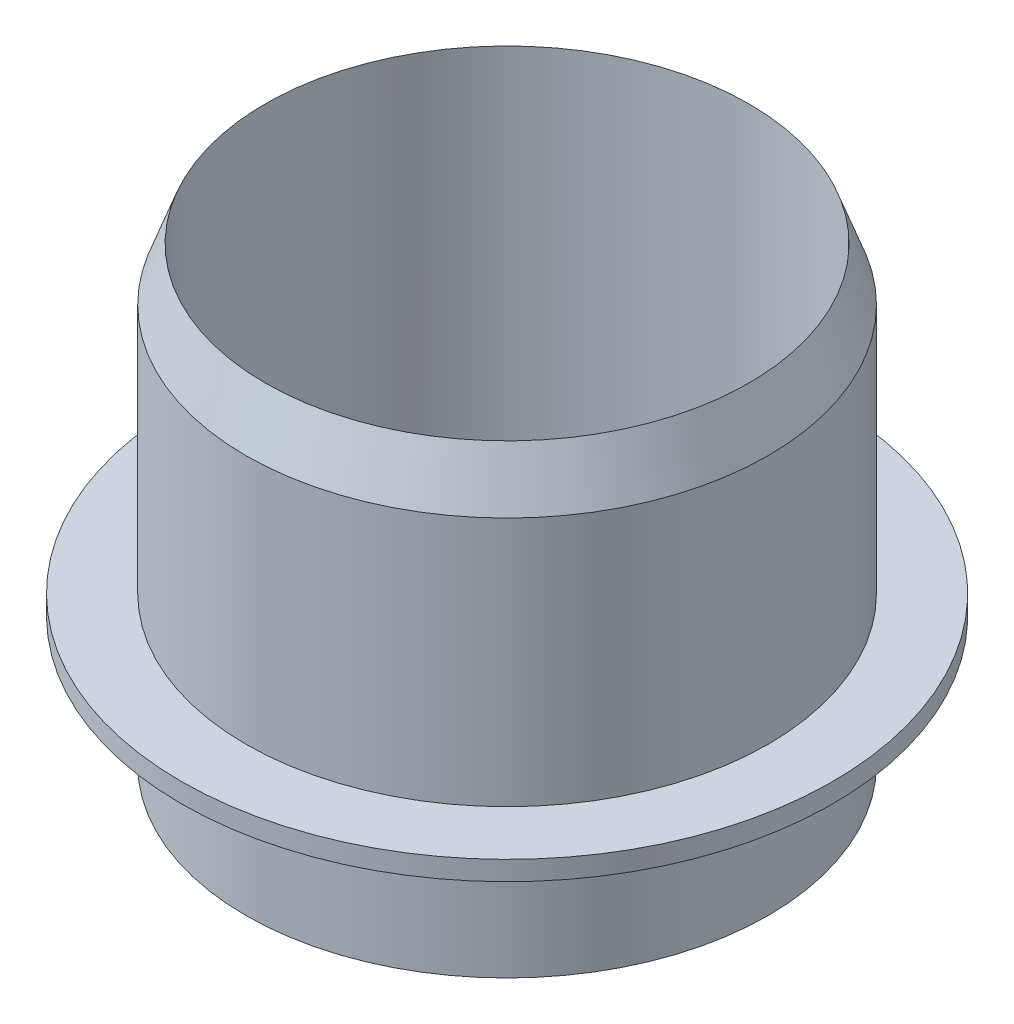
from build123d import *

# Parameters (mm, degrees)
SKETCH_1_R        = 40.5
SKETCH_1_R_2      = 37.5
EXTRUDE_1_DEPTH   = 70
SKETCH_3_R        = 50.5
SKETCH_3_R_2      = 40.5
EXTRUDE_1_2_DEPTH = 3


# Read off the part's stored shape, not the designer's step: Вырез-Повернуть-Тонкостенный1
with BuildPart() as part:
    # Эскиз1 → Extrude 1 (new body)
    with BuildSketch(Plane(origin=(0, 0, 0), x_dir=(1, 0, 0), z_dir=(0, 1, 0))):
        Circle(SKETCH_1_R)
        Circle(SKETCH_1_R_2, mode=Mode.SUBTRACT)
    extrude(amount=EXTRUDE_1_DEPTH)

    # Вырез-Повернуть-Тонкостенный1 outline → Вырез-Повернуть-Тонкостенный1 (revolve, cut)
    with BuildSketch(Plane.XY):
        Polygon((40.5, 70), (37.5, 70), (40.5, 61.757567742), align=None)
    revolve(axis=Axis((0, 0, 0), (0, 1, 0)), mode=Mode.SUBTRACT)

    # Эскиз3 → Extrude 1 2 (add)
    with BuildSketch(Plane(origin=(0, 20, 0), x_dir=(1, 0, 0), z_dir=(0, 1, 0))):
        with Locations(Location((0, 0, 0), (0, 0, 270))):
            Circle(SKETCH_3_R)
        Circle(SKETCH_3_R_2, mode=Mode.SUBTRACT)
    extrude(amount=EXTRUDE_1_2_DEPTH)


solid = part.part
